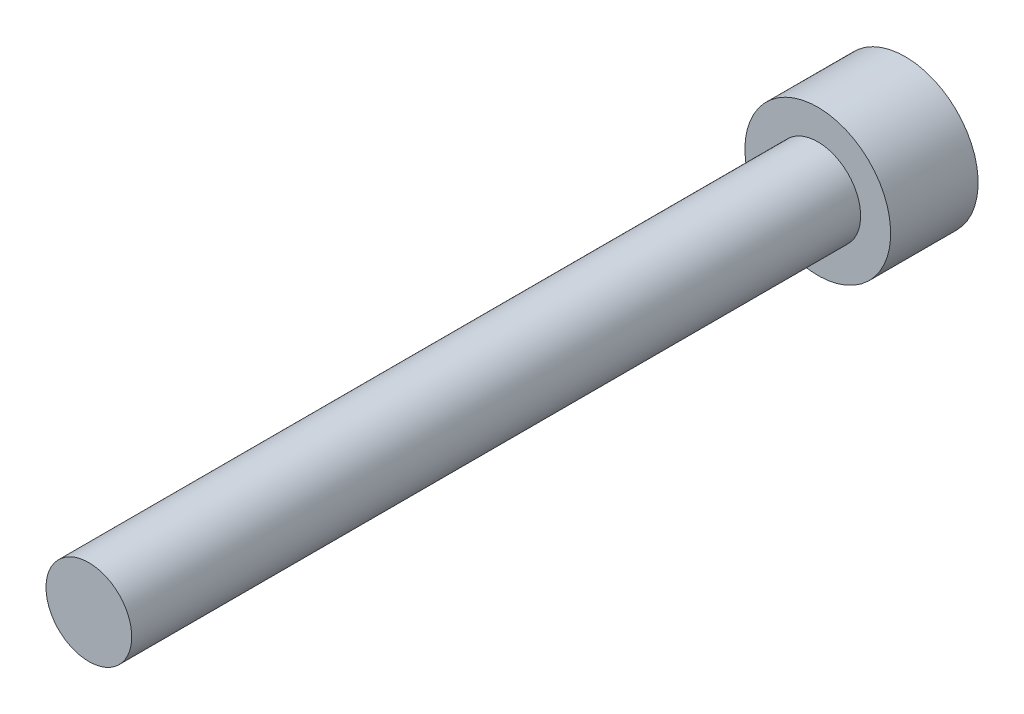
from build123d import *

# Parameters (mm, degrees)
CUT_EXTRUDE1_DEPTH = 2.5


with BuildPart() as part:
    # Sketch1 → Revolve1 (revolve)
    with BuildSketch(Plane(origin=(0, 0, 0), x_dir=(1, 0, 0), z_dir=(0, 1, 0))):
        Polygon((0, 6), (-5, 6), (-5, 0), (-2.94, 0), (-2.94, -50), (0, -50), align=None)
    revolve(axis=Axis((0, 0, -6), (0, 0, 1)))

    # Sketch2 → Cut-Extrude1 (cut)
    with BuildSketch(Plane(origin=(0, 0, -6), x_dir=(-1, 0, 0), z_dir=(0, 0, -1))):
        Polygon((-1.665655527, 2.885), (-3.331311053, 0), (-1.665655527, -2.885), (1.665655527, -2.885), (3.331311053, 0), (1.665655527, 2.885), align=None)
    extrude(amount=-CUT_EXTRUDE1_DEPTH, mode=Mode.SUBTRACT)

    # Sketch3 → Cut-Revolve1 (revolve, cut)
    with BuildSketch(Plane(origin=(0, 0, 0), x_dir=(1, 0, 0), z_dir=(0, 1, 0))):
        Polygon((-3.331311053, 6), (-1.331311053, 4), (-1.331311053, 6), align=None)
    revolve(axis=Axis((0, 0, 0), (0, 0, -1)), mode=Mode.SUBTRACT)


solid = part.part
